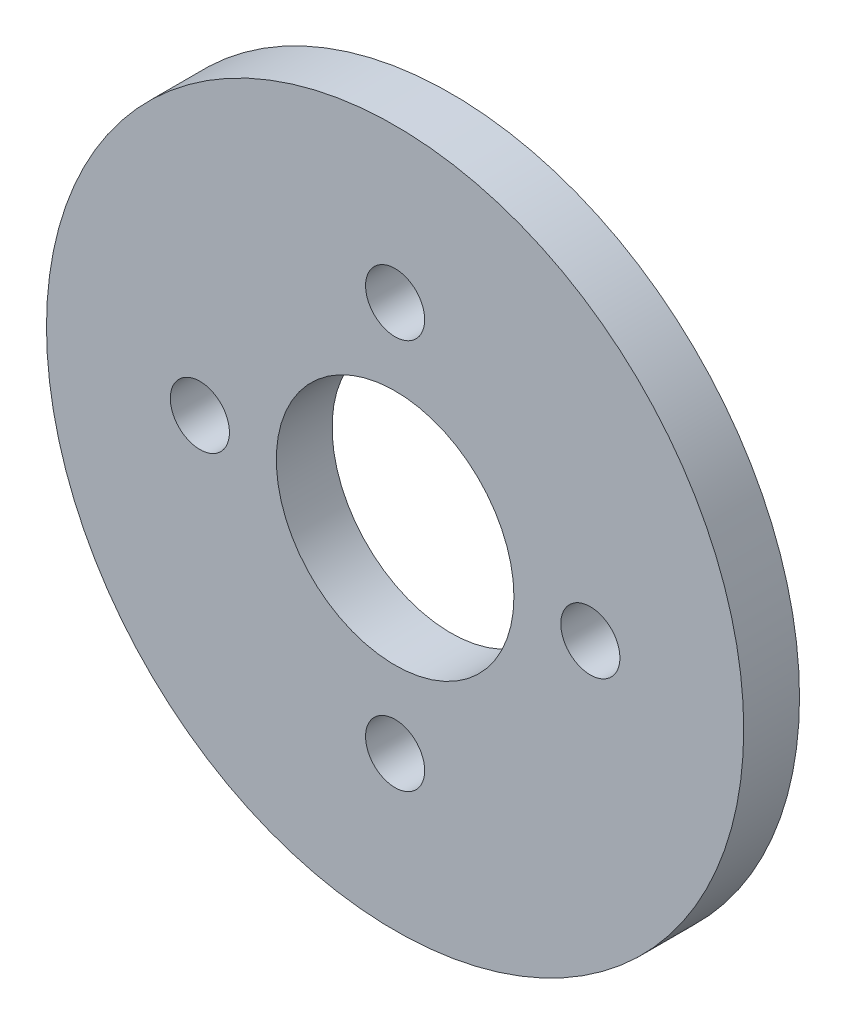
from build123d import *

# Parameters (mm, degrees)
SZKIC1_R                    = 62.5
SZKIC1_R_2                  = 5.3
SZKIC1_R_3                  = 21.3
DODANIE_WYCI_GNI_CIE3_DEPTH = 10


with BuildPart() as part:
    # Szkic1 → Dodanie-wyciągnięcie3 (new body)
    with BuildSketch(Plane.XY):
        Circle(SZKIC1_R)
        with Locations((0, -35)):
            Circle(SZKIC1_R_2, mode=Mode.SUBTRACT)
        with Locations((-35, 0)):
            Circle(SZKIC1_R_2, mode=Mode.SUBTRACT)
        Circle(SZKIC1_R_3, mode=Mode.SUBTRACT)
        with Locations((35, 0)):
            Circle(SZKIC1_R_2, mode=Mode.SUBTRACT)
        with Locations((0, 35)):
            Circle(SZKIC1_R_2, mode=Mode.SUBTRACT)
    extrude(amount=DODANIE_WYCI_GNI_CIE3_DEPTH)


solid = part.part
